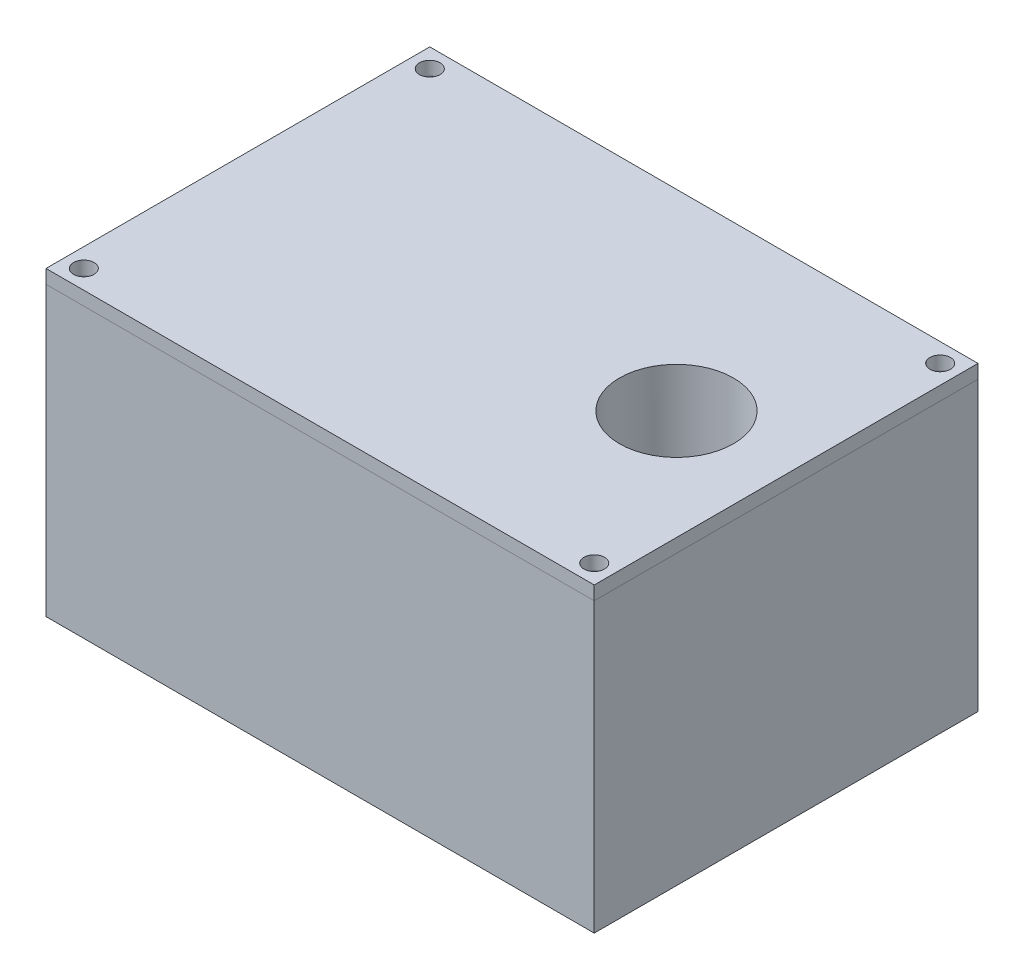
from build123d import *

# Parameters (mm, degrees)
SKETCH1_W           = 127
SKETCH1_H           = 88.9
BOSS_EXTRUDE1_DEPTH = 3.175
SKETCH2_W           = 127
SKETCH2_H           = 88.9
BOSS_EXTRUDE2_DEPTH = 63.5
BOSS_EXTRUDE3_START = 66.675
SKETCH1_2_W         = 127
SKETCH1_2_H         = 88.9
BOSS_EXTRUDE3_DEPTH = 3.175
SKETCH3_R           = 2.38125
CUT_EXTRUDE1_DEPTH  = 25.4
CUT_EXTRUDE2_START  = 3.175
SKETCH3_2_R         = 2.38125
CUT_EXTRUDE2_DEPTH  = 28.575
SKETCH4_R           = 7.62
CUT_EXTRUDE3_DEPTH  = 3.175
SKETCH5_W           = 12.7
SKETCH5_H           = 7.9375
CUT_EXTRUDE4_DEPTH  = 3.175
FILLET1_R           = 1.27
BOSS_EXTRUDE4_REACH = 169.675
SKETCH6_W           = 6.35
SKETCH6_H           = 9.525
MOVE_FACE1_BY       = 0.254
MOVE_FACE1_2_BY     = 0.254
MOVE_FACE1_3_BY     = 0.254
MOVE_FACE1_4_BY     = 0.254
BOSS_EXTRUDE5_REACH = 158.51
SKETCH7_W           = 6.35
SKETCH7_H           = 9.525
BOSS_EXTRUDE6_START = -3.175
SKETCH8_W           = 29.21
SKETCH8_H           = 29.21
BOSS_EXTRUDE6_DEPTH = 44.45
SKETCH4_3_R         = 7.62
CUT_EXTRUDE5_DEPTH  = 44.45
SKETCH9_R           = 12.7
CUT_EXTRUDE6_DEPTH  = 41.275
MOVE_FACE2_BY       = 0.508
MOVE_FACE3_BY       = 0.508
CUT_EXTRUDE7_DEPTH  = 9.525
BOSS_EXTRUDE7_START = 6.35
BOSS_EXTRUDE7_DEPTH = 6.35
FILLET4_R           = 12.7
FILLET5_R           = 3.175
MOVE_FACE4_BY       = 0.254
MOVE_FACE4_2_BY     = 0.254
MOVE_FACE4_3_BY     = 0.254
MOVE_FACE4_4_BY     = 0.254
MOVE_FACE4_5_BY     = 0.254
MOVE_FACE4_6_BY     = 0.254
MOVE_FACE4_7_BY     = 0.254
MOVE_FACE4_8_BY     = 0.254


with BuildPart() as part:
    # Sketch1 → Boss-Extrude1 (new body)
    with BuildSketch(Plane(origin=(0, 0, 0), x_dir=(1, 0, 0), z_dir=(0, 1, 0))):
        with Locations((63.5, 44.45)):
            Rectangle(SKETCH1_W, SKETCH1_H)
    extrude(amount=BOSS_EXTRUDE1_DEPTH)

    # Sketch2 → Boss-Extrude2 (add)
    with BuildSketch(Plane(origin=(0, 3.175, 0), x_dir=(1, 0, 0), z_dir=(0, 1, 0))):
        with Locations((63.5, 44.45)):
            Rectangle(SKETCH2_W, SKETCH2_H)
        with BuildLine():
            Line((22.225, 3.175), (104.775, 3.175))
            ThreePointArc((104.775, 3.175), (118.245384182, 8.754615818), (123.825, 22.225))
            Line((123.825, 22.225), (123.825, 66.675))
            ThreePointArc((123.825, 66.675), (118.245384182, 80.145384182), (104.775, 85.725))
            Line((104.775, 85.725), (22.225, 85.725))
            ThreePointArc((22.225, 85.725), (8.754615818, 80.145384182), (3.175, 66.675))
            Line((3.175, 66.675), (3.175, 22.225))
            ThreePointArc((3.175, 22.225), (8.754615818, 8.754615818), (22.225, 3.175))
        make_face(mode=Mode.SUBTRACT)
    extrude(amount=BOSS_EXTRUDE2_DEPTH)

    # Sketch3 → Cut-Extrude1 (cut)
    with BuildSketch(Plane(origin=(0, 66.675, 0), x_dir=(1, 0, 0), z_dir=(0, 1, 0))):
        with Locations(Location((4.377307909, 84.522692091, 0), (0, 0, 270))):
            Circle(SKETCH3_R)
        with Locations(Location((122.622692091, 4.377307909, 0), (0, 0, 270))):
            Circle(SKETCH3_R)
        with Locations(Location((122.622692091, 84.522692091, 0), (0, 0, 90))):
            Circle(SKETCH3_R)
        with Locations(Location((4.377307909, 4.377307909, 0), (0, 0, 90))):
            Circle(SKETCH3_R)
    extrude(amount=-CUT_EXTRUDE1_DEPTH, mode=Mode.SUBTRACT)

    # Sketch5 → Cut-Extrude4 (cut)
    with BuildSketch(Plane.ZY):
        with Locations((-44.45, 19.84375)):
            Rectangle(SKETCH5_W, SKETCH5_H)
    extrude(amount=-CUT_EXTRUDE4_DEPTH, mode=Mode.SUBTRACT)

    # Fillet1
    fillet1_edges = [part.edges().sort_by_distance(p)[0] for p in [
        (0, 19.84375, -38.1),
        (0, 23.8125, -44.45),
        (0, 19.84375, -50.8),
        (0, 15.875, -44.45),
        (1.5875, 23.8125, -50.8),
        (1.5875, 15.875, -50.8),
        (1.5875, 15.875, -38.1),
        (1.5875, 23.8125, -38.1),
    ]]
    fillet(fillet1_edges, radius=FILLET1_R)


with BuildPart() as body_2:
    # Sketch1<2> → Boss-Extrude3 (new body)
    with BuildSketch(Plane(origin=(0, 0, 0), x_dir=(1, 0, 0), z_dir=(0, 1, 0)).offset(BOSS_EXTRUDE3_START)):
        with Locations((63.5, 44.45)):
            Rectangle(SKETCH1_2_W, SKETCH1_2_H)
    extrude(amount=BOSS_EXTRUDE3_DEPTH)

    # Sketch3<2> → Cut-Extrude2 (cut)
    with BuildSketch(Plane(origin=(0, 66.675, 0), x_dir=(1, 0, 0), z_dir=(0, 1, 0)).offset(CUT_EXTRUDE2_START)):
        with Locations(Location((4.377307909, 84.522692091, 0), (0, 0, 90))):
            Circle(SKETCH3_2_R)
        with Locations(Location((122.622692091, 4.377307909, 0), (0, 0, 90))):
            Circle(SKETCH3_2_R)
        with Locations(Location((122.622692091, 84.522692091, 0), (0, 0, 90))):
            Circle(SKETCH3_2_R)
        with Locations(Location((4.377307909, 4.377307909, 0), (0, 0, 90))):
            Circle(SKETCH3_2_R)
    extrude(amount=-CUT_EXTRUDE2_DEPTH, mode=Mode.SUBTRACT)

    # Sketch4 → Cut-Extrude3 (cut)
    with BuildSketch(Plane(origin=(0, 69.85, 0), x_dir=(1, 0, 0), z_dir=(0, 1, 0))):
        with Locations(Location((101.6, 44.45, 0), (0, 0, 270))):
            Circle(SKETCH4_R)
    extrude(amount=-CUT_EXTRUDE3_DEPTH, mode=Mode.SUBTRACT)


    # Sketch6 → Boss-Extrude4 (add, up to next)
    with BuildSketch(Plane.ZY.offset(-123.825), mode=Mode.PRIVATE) as boss_extrude4_sk1:
        with Locations((-62.23, 61.9125)):
            Rectangle(SKETCH6_W, SKETCH6_H)
    boss_extrude4_tool1 = extrude(boss_extrude4_sk1.sketch, amount=BOSS_EXTRUDE4_REACH, mode=Mode.PRIVATE) - part.part
    # Sketch6 → Boss-Extrude4 (add, up to next)
    with BuildSketch(Plane.ZY.offset(-123.825), mode=Mode.PRIVATE) as boss_extrude4_sk2:
        with Locations((-26.67, 61.9125)):
            Rectangle(SKETCH6_W, SKETCH6_H)
    boss_extrude4_tool2 = extrude(boss_extrude4_sk2.sketch, amount=BOSS_EXTRUDE4_REACH, mode=Mode.PRIVATE) - part.part
    add(boss_extrude4_tool1.solids().sort_by_distance((123.825, 61.9125, -62.23))[0])
    add(boss_extrude4_tool2.solids().sort_by_distance((123.825, 61.9125, -26.67))[0])

    # Move Face1: a face moved inward by 0.254
    extrude(body_2.faces().sort_by_distance((123.825, 61.9125, -62.23))[0], amount=MOVE_FACE1_BY, dir=(-1, 0, 0), mode=Mode.SUBTRACT)

    # Move Face1 2: a face moved inward by 0.254
    extrude(body_2.faces().sort_by_distance((123.825, 61.9125, -26.67))[0], amount=MOVE_FACE1_2_BY, dir=(-1, 0, 0), mode=Mode.SUBTRACT)

    # Move Face1 3: a face moved inward by 0.254
    extrude(body_2.faces().sort_by_distance((3.175, 61.9125, -26.67))[0], amount=MOVE_FACE1_3_BY, dir=(1, 0, 0), mode=Mode.SUBTRACT)

    # Move Face1 4: a face moved inward by 0.254
    extrude(body_2.faces().sort_by_distance((3.175, 61.9125, -62.23))[0], amount=MOVE_FACE1_4_BY, dir=(1, 0, 0), mode=Mode.SUBTRACT)

    # Sketch7 → Boss-Extrude5 (add, up to next)
    with BuildSketch(Plane.XY.offset(-59.055), mode=Mode.PRIVATE) as boss_extrude5_sk1:
        with Locations((25.654, 61.9125)):
            Rectangle(SKETCH7_W, SKETCH7_H)
    boss_extrude5_tool1 = extrude(boss_extrude5_sk1.sketch, amount=BOSS_EXTRUDE5_REACH, mode=Mode.PRIVATE) - body_2.part
    add(boss_extrude5_tool1.solids().sort_by_distance((25.654, 61.9125, -59.055))[0])

    # Sketch8 → Boss-Extrude6 (add)
    with BuildSketch(Plane.XZ.offset(-66.675).offset(BOSS_EXTRUDE6_START)):
        with Locations((101.6, -44.45)):
            Rectangle(SKETCH8_W, SKETCH8_H)
    extrude(amount=BOSS_EXTRUDE6_DEPTH)

    # Sketch4<3> → Cut-Extrude5 (cut)
    with BuildSketch(Plane(origin=(0, 69.85, 0), x_dir=(1, 0, 0), z_dir=(0, 1, 0))):
        with Locations(Location((101.6, 44.45, 0), (0, 0, 270))):
            Circle(SKETCH4_3_R)
    extrude(amount=-CUT_EXTRUDE5_DEPTH, mode=Mode.SUBTRACT)

    # Sketch9 → Cut-Extrude6 (cut)
    with BuildSketch(Plane(origin=(0, 69.85, 0), x_dir=(1, 0, 0), z_dir=(0, 1, 0))):
        with Locations(Location((101.6, 44.45, 0), (0, 0, 270))):
            Circle(SKETCH9_R)
    extrude(amount=-CUT_EXTRUDE6_DEPTH, mode=Mode.SUBTRACT)

    # Move Face2: a curved face moved inward by 0.508
    add(Solid.thicken(body_2.faces().sort_by_distance((101.6, 49.2125, -57.15))[0], -MOVE_FACE2_BY), mode=Mode.SUBTRACT)

    # Move Face3: a face moved inward by 0.508
    extrude(body_2.faces().sort_by_distance((91.0336, 28.575, -44.45))[0], amount=MOVE_FACE3_BY, dir=(0, -1, 0), mode=Mode.SUBTRACT)

    # Sketch10 → Cut-Extrude7 (cut)
    with BuildSketch(Plane.XZ.offset(-57.15)):
        Polygon((22.479, -59.055), (3.429, -59.055), (3.429, -65.405), (123.571, -65.405), (123.571, -59.055), (116.205, -59.055), (86.995, -59.055), (28.829, -59.055), (28.829, -29.845), (86.995, -29.845), (116.205, -29.845), (123.571, -29.845), (123.571, -23.495), (3.429, -23.495), (3.429, -29.845), (22.479, -29.845), align=None)
    extrude(amount=-CUT_EXTRUDE7_DEPTH, mode=Mode.SUBTRACT)

    # Sketch11 → Boss-Extrude7 (add)
    with BuildSketch(Plane.XZ.offset(-66.675).offset(BOSS_EXTRUDE7_START)):
        with BuildLine():
            Line((123.825, -22.225), (123.825, -66.675))
            ThreePointArc((123.825, -66.675), (118.245384182, -80.145384182), (104.775, -85.725))
            Line((104.775, -85.725), (22.225, -85.725))
            ThreePointArc((22.225, -85.725), (8.754615818, -80.145384182), (3.175, -66.675))
            Line((3.175, -66.675), (3.175, -22.225))
            ThreePointArc((3.175, -22.225), (8.754615818, -8.754615818), (22.225, -3.175))
            Line((22.225, -3.175), (104.775, -3.175))
            ThreePointArc((104.775, -3.175), (118.245384182, -8.754615818), (123.825, -22.225))
        make_face()
        with BuildLine():
            Line((22.225, -6.35), (104.775, -6.35))
            ThreePointArc((104.775, -6.35), (116.000320151, -10.999679849), (120.65, -22.225))
            Line((120.65, -22.225), (120.65, -66.675))
            ThreePointArc((120.65, -66.675), (116.000320151, -77.900320151), (104.775, -82.55))
            Line((104.775, -82.55), (22.225, -82.55))
            ThreePointArc((22.225, -82.55), (10.999679849, -77.900320151), (6.35, -66.675))
            Line((6.35, -66.675), (6.35, -22.225))
            ThreePointArc((6.35, -22.225), (10.999679849, -10.999679849), (22.225, -6.35))
        make_face(mode=Mode.SUBTRACT)
    extrude(amount=-BOSS_EXTRUDE7_DEPTH)

    # Fillet4
    fillet4_edges = [body_2.edges().sort_by_distance(p)[0] for p in [
        (116.205, 46.0375, -29.845),
        (86.995, 46.0375, -59.055),
        (116.205, 46.0375, -59.055),
        (86.995, 46.0375, -29.845),
    ]]
    fillet(fillet4_edges, radius=FILLET4_R)

    # Fillet5
    # the kernel refuses this fillet: 3.175 mm, written as the material it adds along each edge
    with BuildSketch(Plane(origin=(104.775, 66.675, -66.675), x_dir=(1, 0, 0), z_dir=(0, 0, 1))) as fillet5_piece_1:
        with BuildLine():
            CenterArc((15.875 - FILLET5_R, -FILLET5_R), FILLET5_R, 0, 90)
            Line((15.875, -FILLET5_R), (15.875, 0))
            Line((15.875, 0), (15.875 - FILLET5_R, 0))
        make_face()
    revolve(axis=Axis((104.775, 66.675, -66.675), (0, 1, 0)), revolution_arc=90)
    with BuildSketch(Plane(origin=(120.65, 66.675, -22.225), x_dir=(-1, 0, 0), z_dir=(0, 0, -1)), Plane(origin=(6.35, 66.675, -66.675), x_dir=(1, 0, 0), z_dir=(0, 0, 1))) as fillet5_piece_2:
        with BuildLine():
            CenterArc((FILLET5_R, -FILLET5_R), FILLET5_R, 90, 90)
            Line((0, -FILLET5_R), (0, 0))
            Line((0, 0), (FILLET5_R, 0))
        make_face()
    extrude(amount=44.45)
    with BuildSketch(Plane(origin=(104.775, 66.675, -22.225), x_dir=(0, 0, 1), z_dir=(-1, 0, 0))) as fillet5_piece_3:
        with BuildLine():
            CenterArc((15.875 - FILLET5_R, -FILLET5_R), FILLET5_R, 0, 90)
            Line((15.875, -FILLET5_R), (15.875, 0))
            Line((15.875, 0), (15.875 - FILLET5_R, 0))
        make_face()
    revolve(axis=Axis((104.775, 66.675, -22.225), (0, 1, 0)), revolution_arc=90)
    with BuildSketch(Plane(origin=(22.225, 66.675, -6.35), x_dir=(0, 0, -1), z_dir=(1, 0, 0)), Plane(origin=(104.775, 66.675, -82.55), x_dir=(0, 0, 1), z_dir=(-1, 0, 0))) as fillet5_piece_4:
        with BuildLine():
            CenterArc((FILLET5_R, -FILLET5_R), FILLET5_R, 90, 90)
            Line((0, -FILLET5_R), (0, 0))
            Line((0, 0), (FILLET5_R, 0))
        make_face()
    extrude(amount=82.55)
    with BuildSketch(Plane(origin=(22.225, 66.675, -22.225), x_dir=(-1, 0, 0), z_dir=(0, 0, -1))) as fillet5_piece_5:
        with BuildLine():
            CenterArc((15.875 - FILLET5_R, -FILLET5_R), FILLET5_R, 0, 90)
            Line((15.875, -FILLET5_R), (15.875, 0))
            Line((15.875, 0), (15.875 - FILLET5_R, 0))
        make_face()
    revolve(axis=Axis((22.225, 66.675, -22.225), (0, 1, 0)), revolution_arc=90)
    with BuildSketch(Plane(origin=(22.225, 66.675, -66.675), x_dir=(0, 0, -1), z_dir=(1, 0, 0))) as fillet5_piece_6:
        with BuildLine():
            CenterArc((15.875 - FILLET5_R, -FILLET5_R), FILLET5_R, 0, 90)
            Line((15.875, -FILLET5_R), (15.875, 0))
            Line((15.875, 0), (15.875 - FILLET5_R, 0))
        make_face()
    revolve(axis=Axis((22.225, 66.675, -66.675), (0, 1, 0)), revolution_arc=90)
    with BuildSketch(Plane(origin=(99.695, 66.675, -29.845), x_dir=(0, 0, 1), z_dir=(1, 0, 0)), Plane(origin=(116.205, 66.675, -42.545), x_dir=(1, 0, 0), z_dir=(0, 0, -1)), Plane(origin=(103.505, 66.675, -59.055), x_dir=(0, 0, -1), z_dir=(-1, 0, 0)), Plane(origin=(86.995, 66.675, -46.355), x_dir=(-1, 0, 0), z_dir=(0, 0, 1))) as fillet5_piece_7:
        with BuildLine():
            CenterArc((FILLET5_R, FILLET5_R), FILLET5_R, 180, 90)
            Line((0, FILLET5_R), (0, 0))
            Line((0, 0), (FILLET5_R, 0))
        make_face()
    extrude(amount=3.81)
    with BuildSketch(Plane(origin=(103.505, 66.675, -42.545), x_dir=(1, 0, 0), z_dir=(0, 0, -1))) as fillet5_piece_8:
        with BuildLine():
            CenterArc((12.7 + FILLET5_R, FILLET5_R), FILLET5_R, 180, 90)
            Line((12.7, FILLET5_R), (12.7, 0))
            Line((12.7, 0), (12.7 + FILLET5_R, 0))
        make_face()
    revolve(axis=Axis((103.505, 66.675, -42.545), (0, -1, 0)), revolution_arc=90)
    with BuildSketch(Plane(origin=(103.505, 66.675, -46.355), x_dir=(1, 0, 0), z_dir=(0, 0, 1))) as fillet5_piece_9:
        with BuildLine():
            CenterArc((12.7 + FILLET5_R, -FILLET5_R), FILLET5_R, 90, 90)
            Line((12.7, -FILLET5_R), (12.7, 0))
            Line((12.7, 0), (12.7 + FILLET5_R, 0))
        make_face()
    revolve(axis=Axis((103.505, 66.675, -46.355), (0, 1, 0)), revolution_arc=90)
    with BuildSketch(Plane(origin=(99.695, 66.675, -46.355), x_dir=(0, 0, -1), z_dir=(1, 0, 0))) as fillet5_piece_10:
        with BuildLine():
            CenterArc((12.7 + FILLET5_R, -FILLET5_R), FILLET5_R, 90, 90)
            Line((12.7, -FILLET5_R), (12.7, 0))
            Line((12.7, 0), (12.7 + FILLET5_R, 0))
        make_face()
    revolve(axis=Axis((99.695, 66.675, -46.355), (0, 1, 0)), revolution_arc=90)
    with BuildSketch(Plane(origin=(99.695, 66.675, -42.545), x_dir=(0, 0, 1), z_dir=(1, 0, 0))) as fillet5_piece_11:
        with BuildLine():
            CenterArc((12.7 + FILLET5_R, FILLET5_R), FILLET5_R, 180, 90)
            Line((12.7, FILLET5_R), (12.7, 0))
            Line((12.7, 0), (12.7 + FILLET5_R, 0))
        make_face()
    revolve(axis=Axis((99.695, 66.675, -42.545), (0, -1, 0)), revolution_arc=90)

    # Move Face4: a curved face moved inward by 0.254
    add(Solid.thicken(body_2.faces().sort_by_distance((8.754615818, 63.5, -8.754615818))[0], -MOVE_FACE4_BY), mode=Mode.SUBTRACT)

    # Move Face4 2: a face moved inward by 0.254
    extrude(body_2.faces().sort_by_distance((3.175, 63.5, -44.45))[0], amount=MOVE_FACE4_2_BY, dir=(1, 0, 0), mode=Mode.SUBTRACT)

    # Move Face4 3: a curved face moved inward by 0.254
    add(Solid.thicken(body_2.faces().sort_by_distance((8.754615818, 63.5, -80.145384182))[0], -MOVE_FACE4_3_BY), mode=Mode.SUBTRACT)

    # Move Face4 4: a face moved inward by 0.254
    extrude(body_2.faces().sort_by_distance((63.5, 63.5, -85.725))[0], amount=MOVE_FACE4_4_BY, dir=(0, 0, 1), mode=Mode.SUBTRACT)

    # Move Face4 5: a curved face moved inward by 0.254
    add(Solid.thicken(body_2.faces().sort_by_distance((118.245384182, 63.5, -80.145384182))[0], -MOVE_FACE4_5_BY), mode=Mode.SUBTRACT)

    # Move Face4 6: a face moved inward by 0.254
    extrude(body_2.faces().sort_by_distance((123.825, 63.5, -44.45))[0], amount=MOVE_FACE4_6_BY, dir=(-1, 0, 0), mode=Mode.SUBTRACT)

    # Move Face4 7: a face moved inward by 0.254
    extrude(body_2.faces().sort_by_distance((63.5, 63.5, -3.175))[0], amount=MOVE_FACE4_7_BY, dir=(0, 0, -1), mode=Mode.SUBTRACT)

    # Move Face4 8: a curved face moved inward by 0.254
    add(Solid.thicken(body_2.faces().sort_by_distance((118.245384182, 63.5, -8.754615818))[0], -MOVE_FACE4_8_BY), mode=Mode.SUBTRACT)


solid = Compound([part.part, body_2.part])
